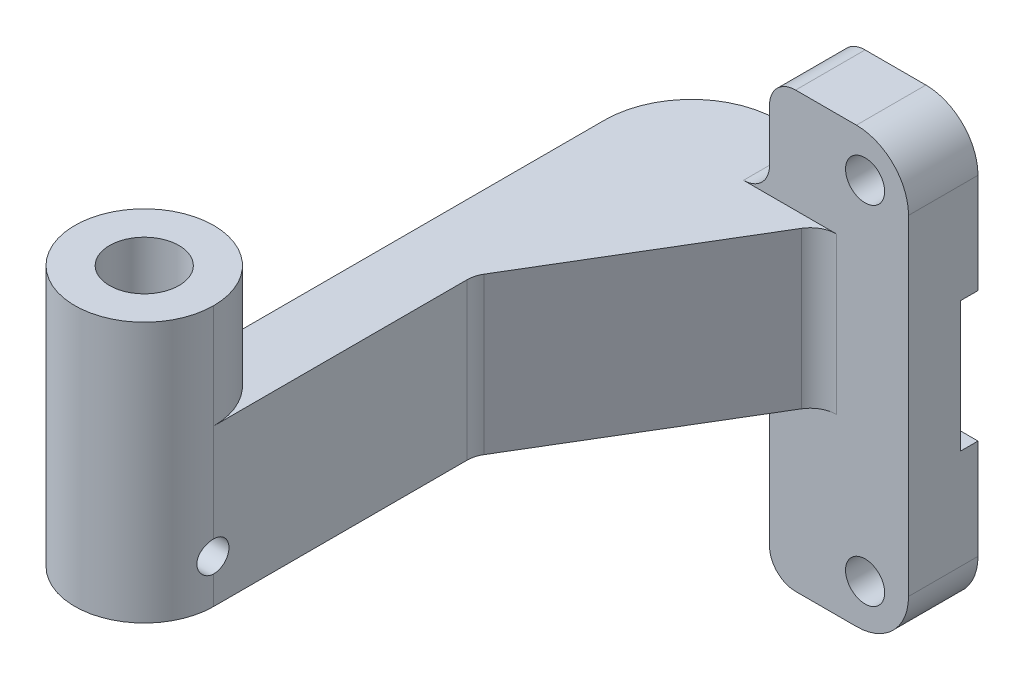
from build123d import *

# Parameters (mm, degrees)
SKETCH_6_R               = 4
EXTRUDE_3_DEPTH          = 25
FILLET_1_R               = 10
FILLET_2_R               = 3
SKETCH_7_R               = 2.25
CUT_EXTRUDE_4_DEPTH      = 50
SKETCH_8_R               = 1.75
CUT_EXTRUDE_5_DEPTH      = 50
EXTRUDE_4_DEPTH          = 5
FILLET_5_R               = 3
FILLET_6_R               = 6
SKETCH_11_W              = 55
SKETCH_11_H              = 12
CUT_EXTRUDE_7_DEPTH      = 17
CUT_EXTRUDE_8_DEPTH      = 80.214897752
CUT_EXTRUDE_8_DEPTH_BACK = 80.214897752
SKETCH_12_W              = 30.277816987
SKETCH_12_H              = 21.642627305
FILLET_7_R               = 8
FILLET_8_R               = 3
FILLET_9_R               = 1
FILLET_10_R              = 3
EXTRUDE_5_DEPTH          = 8
SKETCH_14_W              = 30
SKETCH_14_H              = 15
CUT_EXTRUDE_9_DEPTH      = 2


with BuildPart() as part:
    # 草图6 → 凸台-拉伸3 (new, symmetric)
    with BuildSketch(Plane(origin=(0, 0, 0), x_dir=(1, 0, 0), z_dir=(0, 1, 0))):
        with BuildLine():
            Line((0, 0), (-25, 0))
            Line((-25, 0), (-25, -55))
            ThreePointArc((-25, -55), (-33, -63), (-41, -55))
            ThreePointArc((-41, -55), (-38.656854249, -49.343145751), (-33, -47))
            Line((-33, -47), (-33, 8))
            Line((-33, 8), (0, 8))
            Line((0, 8), (0, 0))
        make_face()
        with Locations(Location((-33, -55, 0), (0, 0, 270))):
            Circle(SKETCH_6_R, mode=Mode.SUBTRACT)
    extrude(amount=EXTRUDE_3_DEPTH, both=True)

    # 圆角1
    fillet_1_edges = [part.edges().sort_by_distance(p)[0] for p in [
        (-33, 0, -8),
    ]]
    fillet(fillet_1_edges, radius=FILLET_1_R)

    # 圆角2
    fillet_2_edges = [part.edges().sort_by_distance(p)[0] for p in [
        (-25, 0, 0),
    ]]
    fillet(fillet_2_edges, radius=FILLET_2_R)

    # 草图7 → 切除-拉伸4 (cut)
    with BuildSketch(Plane(origin=(0, 0, -8), x_dir=(-1, 0, 0), z_dir=(0, 0, -1))):
        with Locations((5, 20)):
            Circle(SKETCH_7_R)
        with Locations((5, -20)):
            Circle(SKETCH_7_R)
    extrude(amount=-CUT_EXTRUDE_4_DEPTH, mode=Mode.SUBTRACT)

    # 草图8 → 切除-拉伸5 (cut)
    with BuildSketch(Plane(origin=(-25, 0, 0), x_dir=(0, 0, -1), z_dir=(1, 0, 0))):
        with Locations((-55, 0)):
            Circle(SKETCH_8_R)
    extrude(amount=-CUT_EXTRUDE_5_DEPTH, mode=Mode.SUBTRACT)

    # 草图9 → 凸台-拉伸4 (add, symmetric)
    with BuildSketch(Plane(origin=(0, 0, 0), x_dir=(1, 0, 0), z_dir=(0, 1, 0))):
        with BuildLine():
            Line((-10, 0), (-25, -25))
            Line((-25, -25), (-25, -3))
            ThreePointArc((-25, -3), (-24.121320344, -0.878679656), (-22, 0))
            Line((-22, 0), (-10, 0))
        make_face()
    extrude(amount=EXTRUDE_4_DEPTH, both=True)

    # 圆角5
    fillet_5_edges = [part.edges().sort_by_distance(p)[0] for p in [
        (-10, 0, 0),
        (-25, 0, 25),
    ]]
    fillet(fillet_5_edges, radius=FILLET_5_R)

    # 圆角6
    fillet_6_edges = [part.edges().sort_by_distance(p)[0] for p in [
        (0, 25, -4),
        (0, -25, -4),
    ]]
    fillet(fillet_6_edges, radius=FILLET_6_R)

    # 草图11 → 切除-拉伸7 (cut)
    with BuildSketch(Plane.ZY.offset(33)):
        with Locations((19.5, 19)):
            Rectangle(SKETCH_11_W, SKETCH_11_H)
        with Locations((19.5, -19)):
            Rectangle(SKETCH_11_W, SKETCH_11_H)
    extrude(amount=-CUT_EXTRUDE_7_DEPTH, mode=Mode.SUBTRACT)

    # 草图12 → 切除-拉伸8 (cut, two sides: drawn at the far end of the back side and taken through both)
    with BuildSketch(Plane.XY.offset(-CUT_EXTRUDE_8_DEPTH_BACK)):
        with Locations((-31.138908494, -15.821313653)):
            Rectangle(SKETCH_12_W, SKETCH_12_H)
    extrude(amount=CUT_EXTRUDE_8_DEPTH + CUT_EXTRUDE_8_DEPTH_BACK, mode=Mode.SUBTRACT)

    # 圆角7
    fillet_7_edges = [part.edges().sort_by_distance(p)[0] for p in [
        (-25, 19, 47),
    ]]
    fillet(fillet_7_edges, radius=FILLET_7_R - 0.0001)  # a hair under: the kernel refuses the full size

    # 圆角8
    fillet_8_edges = [part.edges().sort_by_distance(p)[0] for p in [
        (-16, 13, -4),
        (-16, 25, -4),
    ]]
    fillet(fillet_8_edges, radius=FILLET_8_R)

    # 圆角9
    fillet_9_edges = [part.edges().sort_by_distance(p)[0] for p in [
        (-33, 6.5, 47),
    ]]
    fillet(fillet_9_edges, radius=FILLET_9_R)

    # 圆角10
    fillet_10_edges = [part.edges().sort_by_distance(p)[0] for p in [
        (-16, -25, -4),
        (-16, -5, -4),
    ]]
    fillet(fillet_10_edges, radius=FILLET_10_R)

    # 草图13 → 凸台-拉伸5 (add)
    with BuildSketch(Plane(origin=(0, 5, 0), x_dir=(1, 0, 0), z_dir=(0, 1, 0))):
        with BuildLine():
            Line((-8.301428863, 0), (-22, 0))
            ThreePointArc((-22, 0), (-24.121320344, -0.878679656), (-25, -3))
            Line((-25, -3), (-25, -25.830951895))
            ThreePointArc((-25, -25.830951895), (-24.891144785, -25.030151149), (-24.572478777, -24.287464629))
            Line((-24.572478777, -24.287464629), (-10.87390764, -1.456512734))
            ThreePointArc((-10.87390764, -1.456512734), (-9.779525308, -0.38940028), (-8.301428863, 0))
        make_face()
    extrude(amount=EXTRUDE_5_DEPTH)

    # 草图14 → 切除-拉伸9 (cut)
    with BuildSketch(Plane(origin=(0, 0, -8), x_dir=(-1, 0, 0), z_dir=(0, 0, -1))):
        Rectangle(SKETCH_14_W, SKETCH_14_H)
    extrude(amount=-CUT_EXTRUDE_9_DEPTH, mode=Mode.SUBTRACT)


solid = part.part
